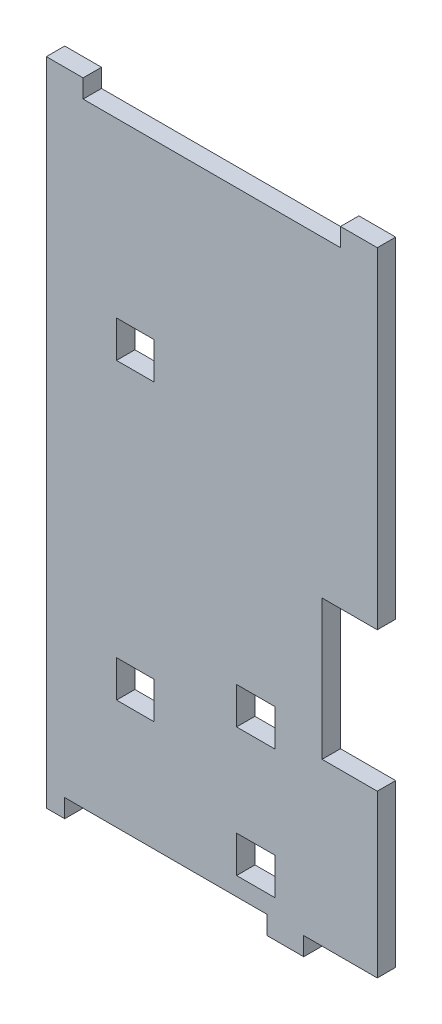
from build123d import *

# Parameters (mm, degrees)
ESQUISSE1_W        = 10.465871206
ESQUISSE1_H        = 10
ESQUISSE1_W_2      = 10.217145077
BOSS_EXTRU_1_DEPTH = 5


with BuildPart() as part:
    # Esquisse1 → Boss.-Extru.1 (new body)
    with BuildSketch(Plane.XY):
        Polygon((90, 82), (90, 167), (90, 172), (80, 172), (80, 167), (10, 167), (10, 172), (0, 172), (0, 167), (0, 0), (0, -5), (5, -5), (5, 0), (60, 0), (60, -5), (70, -5), (70, 0), (90, 0), (90, 44), (75, 44), (75, 82), align=None)
        with Locations((56.967345118, 45)):
            Rectangle(ESQUISSE1_W, ESQUISSE1_H, mode=Mode.SUBTRACT)
        with Locations((56.967345118, 10)):
            Rectangle(ESQUISSE1_W, ESQUISSE1_H, mode=Mode.SUBTRACT)
        with Locations((24.198717413, 115)):
            Rectangle(ESQUISSE1_W_2, ESQUISSE1_H, mode=Mode.SUBTRACT)
        with Locations((24.198717413, 35)):
            Rectangle(ESQUISSE1_W_2, ESQUISSE1_H, mode=Mode.SUBTRACT)
    extrude(amount=BOSS_EXTRU_1_DEPTH)


solid = part.part
